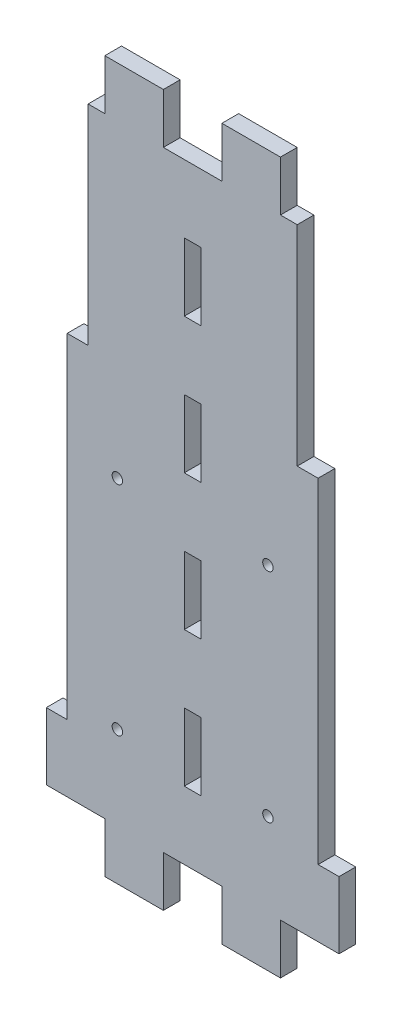
from build123d import *

# Parameters (mm, degrees)
BOSS_EXTRUDE1_DEPTH = 5.08
SKETCH2_R           = 1.5875
CUT_EXTRUDE1_DEPTH  = 220.530070833
SKETCH3_W           = 5.08
SKETCH3_H           = 20.602222222
CUT_EXTRUDE2_DEPTH  = 220.530070833
CUT_EXTRUDE3_DEPTH  = 220.530070833


with BuildPart() as part:
    # Sketch1 → Boss-Extrude1 (new body)
    with BuildSketch(Plane.XY):
        Polygon((0, 0), (17.78, 0), (17.78, 15.24), (35.56, 15.24), (35.56, 0), (53.34, 0), (53.34, 15.24), (71.12, 15.24), (71.12, 0), (88.9, 0), (88.9, -185.42), (71.12, -185.42), (71.12, -200.66), (53.34, -200.66), (53.34, -185.42), (35.56, -185.42), (35.56, -200.66), (17.78, -200.66), (17.78, -185.42), (0, -185.42), align=None)
    extrude(amount=BOSS_EXTRUDE1_DEPTH)

    # Sketch2 → Cut-Extrude1 (cut, through all)
    with BuildSketch(Plane.XY.offset(5.08)):
        with Locations((21.59, -93.98)):
            Circle(SKETCH2_R)
        with Locations((67.31, -93.98)):
            Circle(SKETCH2_R)
        with Locations((67.31, -160.02)):
            Circle(SKETCH2_R)
        with Locations((21.59, -160.02)):
            Circle(SKETCH2_R)
    extrude(amount=-CUT_EXTRUDE1_DEPTH, mode=Mode.SUBTRACT)

    # Sketch3 → Cut-Extrude2 (cut, through all)
    with BuildSketch(Plane(origin=(0, 0, 0), x_dir=(-1, 0, 0), z_dir=(0, 0, -1))):
        with Locations((-44.45, -154.516666667)):
            Rectangle(SKETCH3_W, SKETCH3_H)
        with Locations((-44.45, -72.107777778)):
            Rectangle(SKETCH3_W, SKETCH3_H)
        with Locations((-44.45, -30.903333333)):
            Rectangle(SKETCH3_W, SKETCH3_H)
        with Locations((-44.45, -113.312222222)):
            Rectangle(SKETCH3_W, SKETCH3_H)
    extrude(amount=-CUT_EXTRUDE2_DEPTH, mode=Mode.SUBTRACT)

    # Sketch4 → Cut-Extrude3 (cut, through all)
    with BuildSketch(Plane(origin=(0, 0, 0), x_dir=(-1, 0, 0), z_dir=(0, 0, -1))):
        Polygon((-88.9, 0), (-76.2, 0), (-76.2, -63.5), (-82.55, -63.5), (-82.55, -165.1), (-88.9, -165.1), (-88.9, -63.5), align=None)
        Polygon((-6.35, -63.5), (-12.7, -63.5), (-12.7, 0), (0, 0), (0, -63.5), (0, -165.1), (-6.35, -165.1), align=None)
    extrude(amount=-CUT_EXTRUDE3_DEPTH, mode=Mode.SUBTRACT)


solid = part.part
